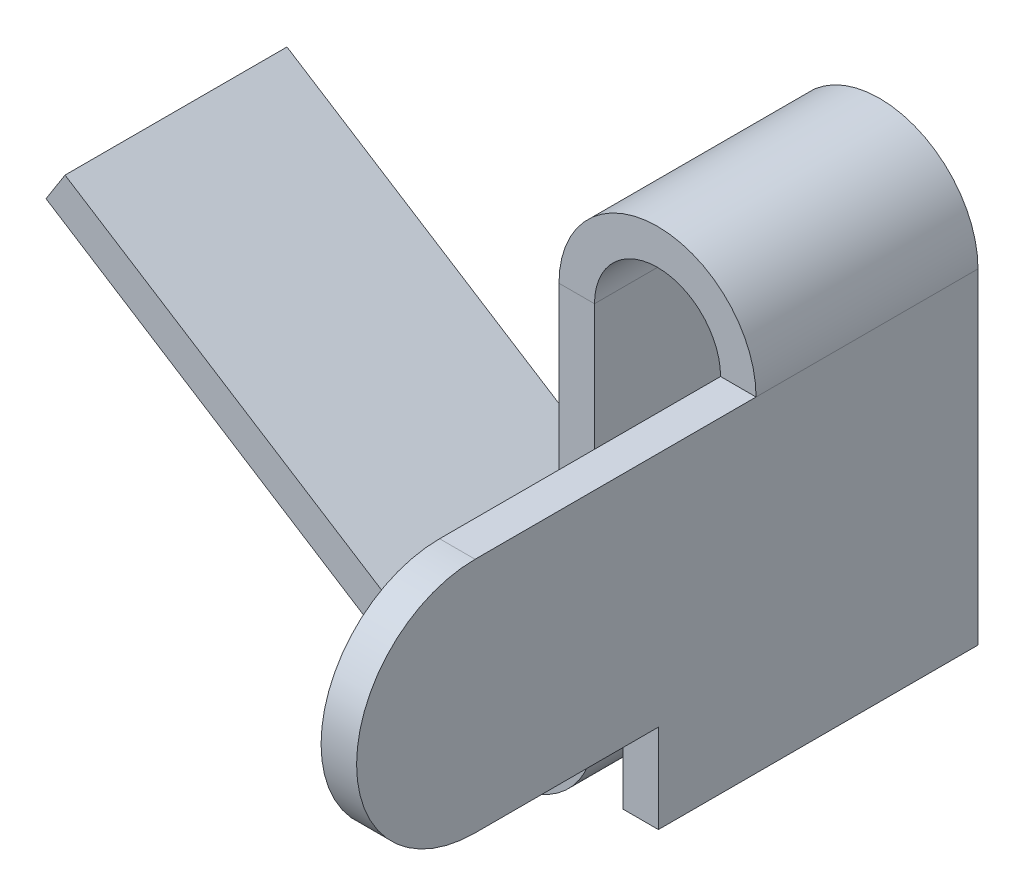
from build123d import *

# Parameters (mm, degrees)
BASE_FLANGE1_DEPTH  = 2.5
SKETCH6_W           = 0.4
SKETCH6_H           = 3.67
BOSS_EXTRUDE1_DEPTH = 4.5
SKETCH7_W           = 3.4
SKETCH7_H           = 1
CUT_EXTRUDE1_DEPTH  = 12.139958989
FILLET1_RADIUS      = 1.335
FILLET1_LENGTH      = 0.4
SCALE1_SCALE        = 10


# Sheet-metal steps are written as plain solids
with BuildPart() as part:
    # Sketch1 → Base-Flange1 (new body)
    with BuildSketch(Plane.XY):
        with BuildLine():
            Line((0.71, -1.835), (0.71, 1.835))
            ThreePointArc((0.71, 1.835), (0, 2.545), (-0.71, 1.835))
            Line((-0.71, 1.835), (-0.71, -2.335))
            ThreePointArc((-0.71, -2.335), (-1.228475759, -3.211432773), (-2.246268811, -3.179047252))
            Line((-2.246268811, -3.179047252), (-6.888528694, -0.229568793))
            Line((-6.888528694, -0.229568793), (-6.67402117, 0.108050107))
            Line((-6.67402117, 0.108050107), (-2.031761286, -2.841428351))
            ThreePointArc((-2.031761286, -2.841428351), (-1.421085455, -2.860859664), (-1.11, -2.335))
            Line((-1.11, -2.335), (-1.11, 1.835))
            ThreePointArc((-1.11, 1.835), (0, 2.945), (1.11, 1.835))
            Line((1.11, 1.835), (1.11, -1.835))
            Line((1.11, -1.835), (0.71, -1.835))
        make_face()
    extrude(amount=BASE_FLANGE1_DEPTH)

    # Sketch6 → Boss-Extrude1 (add)
    with BuildSketch(Plane.XY.offset(2.5)):
        with Locations((0.91, 0)):
            Rectangle(SKETCH6_W, SKETCH6_H)
    extrude(amount=BOSS_EXTRUDE1_DEPTH)

    # Sketch7 → Cut-Extrude1 (cut, through all)
    with BuildSketch(Plane(origin=(1.11, 0, 0), x_dir=(0, 0, -1), z_dir=(1, 0, 0))):
        with Locations((-5.3, -1.335)):
            Rectangle(SKETCH7_W, SKETCH7_H)
    extrude(amount=-CUT_EXTRUDE1_DEPTH, mode=Mode.SUBTRACT)

    # Fillet1: full round fillet: the end face becomes a half cylinder, R = half its width
    fillet1_face = Plane((0.91, 0.5, 7), x_dir=(-1, 0, 0), z_dir=(0, 0, 1))  # on the end face: x along it, z out of the body
    fillet1_slab = fillet1_face.offset(-FILLET1_RADIUS / 2) * Box(FILLET1_LENGTH, 2 * FILLET1_RADIUS, FILLET1_RADIUS, mode=Mode.PRIVATE)  # the body's end, R deep
    fillet1_round = Plane((0.91, 0.5, 5.665), x_dir=(0, 0, 1), z_dir=(-1, 0, 0)) * Cylinder(FILLET1_RADIUS, FILLET1_LENGTH, mode=Mode.PRIVATE)  # its axis R under the face
    add(fillet1_slab - fillet1_round, mode=Mode.SUBTRACT)


with BuildPart() as part_1:
    # Scale1: scaled about (-1.000602335, -0.257853748, 1.947858074)
    add(part.part.scale(SCALE1_SCALE).moved(Location((9.005421015, 2.320683732, -17.530722666))))


solid = part_1.part
